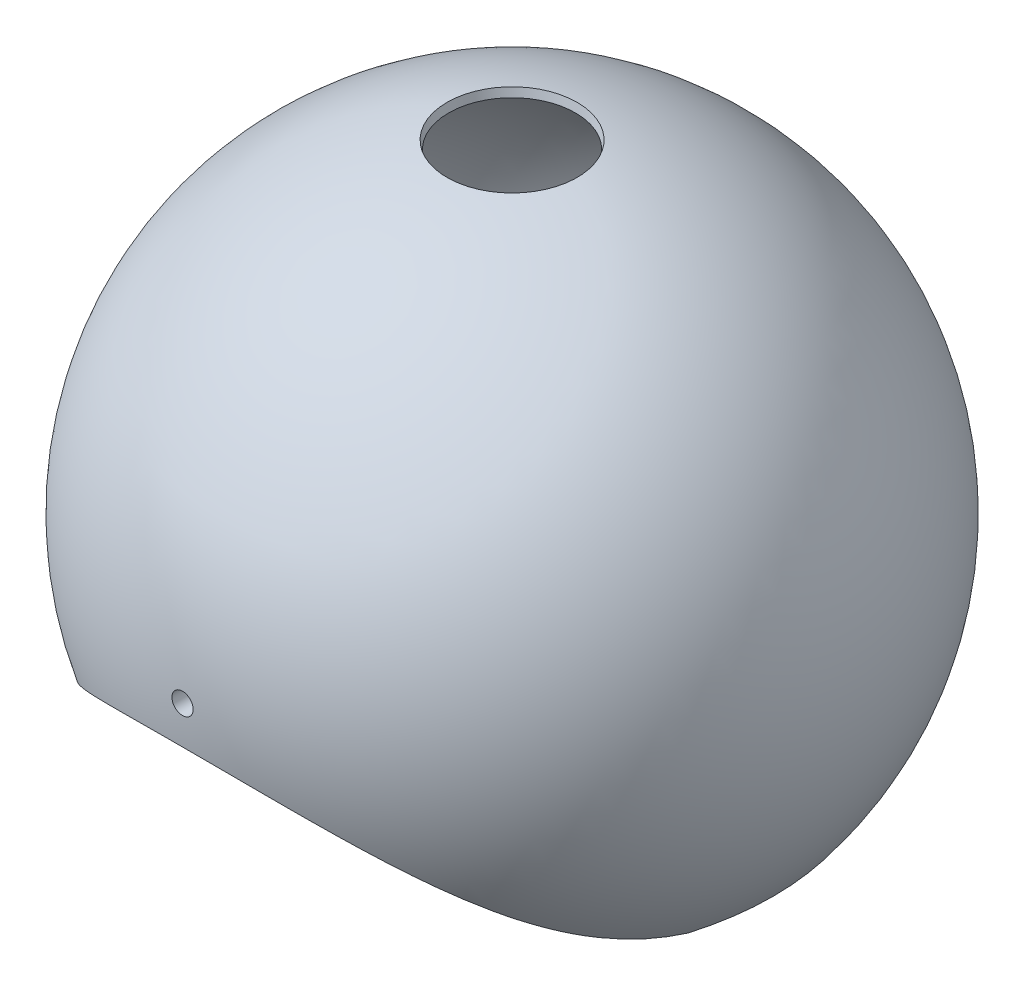
from build123d import *

# Parameters (mm, degrees)
SKETCH2_R               = 5
BOSS_EXTRUDE1_DEPTH     = 10
CUT_EXTRUDE1_START      = -5
SKETCH4_R               = 1.4
CUT_EXTRUDE1_DEPTH      = 5
SKETCH5_R               = 2.45
CUT_EXTRUDE2_DEPTH      = 3
SKETCH6_R               = 2.5
CUT_EXTRUDE3_DEPTH      = 13
SKETCH7_R               = 1
CUT_EXTRUDE4_DEPTH      = 13
CUT_EXTRUDE5_DEPTH      = 190.620679463
CUT_EXTRUDE5_DEPTH_BACK = 190.620679463


with BuildPart() as part:
    # Sketch1 → Revolve1 (revolve)
    with BuildSketch(Plane.XY):
        with BuildLine():
            Line((-61.750890187, -47.653200953), (-59.204496779, -47.653200953))
            ThreePointArc((-59.204496779, -47.653200953), (-71.464924193, 25.860483564), (-15, 74.505033387))
            Line((-15, 74.505033387), (-15.394736842, 76.46569216))
            ThreePointArc((-15.394736842, 76.46569216), (-73.070081767, 27.290349038), (-61.750890187, -47.653200953))
        make_face()
    revolve(axis=Axis((0, 0, 0), (0, 1, 0)))

    # Sketch2 → Boss-Extrude1 (add)
    with BuildSketch(Plane.XY.offset(77)):
        Circle(SKETCH2_R)
    boss_extrude1 = extrude(amount=-BOSS_EXTRUDE1_DEPTH)

    # Sketch3 → Revolve2 (revolve)
    with BuildSketch(Plane.XY):
        with BuildLine():
            Line((-30.219046016, 60.822378228), (-30.219046016, 70.822378228))
            ThreePointArc((-30.219046016, 70.822378228), (-39.040549745, 66.368934567), (-47.219046016, 60.822378228))
            Line((-47.219046016, 60.822378228), (-30.219046016, 60.822378228))
        make_face()
    revolve(axis=Axis((0, 76.46569216, 0), (0, -1, 0)))

    # Sketch4 → Cut-Extrude1 (cut)
    # profile 1 of 3: a face of its own
    with BuildSketch(Plane.XZ.offset(-60.822378228).offset(CUT_EXTRUDE1_START)):
        with Locations((3.2, 34.1)):
            Circle(SKETCH4_R)
    # profile 2 of 3: a face of its own
    with BuildSketch(Plane.XZ.offset(-60.822378228).offset(CUT_EXTRUDE1_START)):
        with Locations((-3.2, 34.1)):
            Circle(SKETCH4_R)
    # profile 3 of 3: a face of its own
    with BuildSketch(Plane.XZ.offset(-60.822378228).offset(CUT_EXTRUDE1_START)):
        with BuildLine():
            Line((19.275, 30.7), (-19.275, 30.7))
            ThreePointArc((-19.275, 30.7), (0, -36.249353443), (19.275, 30.7))
        make_face()
        with BuildLine():
            Line((19.275, 23.273700117), (-19.275, 23.273700117))
            ThreePointArc((-19.275, 23.273700117), (0, -30.219046016), (19.275, 23.273700117))
        make_face(mode=Mode.SUBTRACT)
    extrude(amount=CUT_EXTRUDE1_DEPTH, mode=Mode.SUBTRACT)

    # Mirror1: Boss-Extrude1 across plane
    add(boss_extrude1.mirror(Plane.XY))

    # Sketch5 → Cut-Extrude2 (cut)
    with BuildSketch(Plane(origin=(0, 0, 67), x_dir=(-1, 0, 0), z_dir=(0, 0, -1))):
        Circle(SKETCH5_R)
    extrude(amount=-CUT_EXTRUDE2_DEPTH, mode=Mode.SUBTRACT)

    # Sketch6 → Cut-Extrude3 (cut)
    with BuildSketch(Plane(origin=(0, 0, 72), x_dir=(-1, 0, 0), z_dir=(0, 0, -1))):
        Circle(SKETCH6_R)
    extrude(amount=-CUT_EXTRUDE3_DEPTH, mode=Mode.SUBTRACT)

    # Sketch7 → Cut-Extrude4 (cut)
    with BuildSketch(Plane(origin=(0, 0, 70), x_dir=(-1, 0, 0), z_dir=(0, 0, -1))):
        Circle(SKETCH7_R)
    extrude(amount=-CUT_EXTRUDE4_DEPTH, mode=Mode.SUBTRACT)

    # Sketch8 → Cut-Extrude5 (cut, two sides: drawn at the far end of the back side and taken through both)
    with BuildSketch(Plane.XY.offset(77).offset(-CUT_EXTRUDE5_DEPTH_BACK)):
        with BuildLine():
            Line((59.204496779, -47.653200953), (-59.204496779, -47.653200953))
            ThreePointArc((-59.204496779, -47.653200953), (0, -9.482803282), (59.204496779, -47.653200953))
        make_face()
    extrude(amount=CUT_EXTRUDE5_DEPTH + CUT_EXTRUDE5_DEPTH_BACK, mode=Mode.SUBTRACT)


solid = part.part
